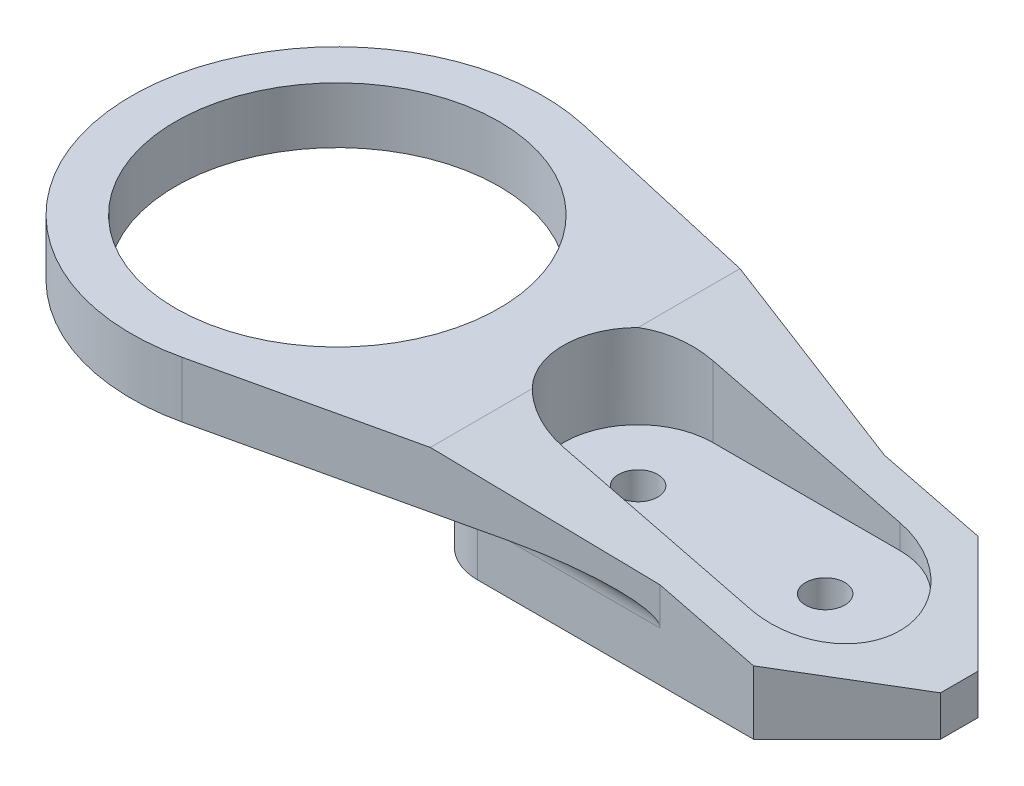
from build123d import *

# Parameters (mm, degrees)
SKETCH1_W           = 25
SKETCH1_H           = 7.15
BOSS_EXTRUDE1_DEPTH = 12
BOSS_EXTRUDE2_DEPTH = 3
CUT_EXTRUDE1_DEPTH  = 21
SKETCH4_R           = 8.65
CUT_EXTRUDE2_DEPTH  = 10
CHAMFER1_SIZE       = 5
CHAMFER1_SIZE2      = 20
CHAMFER2_SIZE       = 5
SKETCH6_R           = 1.05
CUT_EXTRUDE3_DEPTH  = 10
CUT_EXTRUDE4_DEPTH  = 4.5
FILLET1_R           = 3
FILLET2_R           = 1.5


with BuildPart() as part:
    # Sketch1 → Boss-Extrude1 (new body)
    with BuildSketch(Plane.XY):
        with Locations((12.5, 3.575)):
            Rectangle(SKETCH1_W, SKETCH1_H)
    extrude(amount=BOSS_EXTRUDE1_DEPTH)

    # Sketch2 → Boss-Extrude2 (add)
    with BuildSketch(Plane(origin=(0, 7.15, 0), x_dir=(1, 0, 0), z_dir=(0, 1, 0))):
        with BuildLine():
            Line((0, 0), (15, 0))
            Line((15, 0), (-5.804949202, 4.737516245))
            ThreePointArc((-5.804949202, 4.737516245), (-19.262380692, -6), (-5.804949202, -16.737516245))
            Line((-5.804949202, -16.737516245), (15, -12))
            Line((15, -12), (0, -12))
            Line((0, -12), (0, 0))
        make_face()
    extrude(amount=-BOSS_EXTRUDE2_DEPTH)

    # Sketch3 → Cut-Extrude1 (cut)
    with BuildSketch(Plane.XZ.offset(-4.15)):
        Polygon((2.25, 6), (2.25, 12), (0, 12), (0, 0), (2.25, 0), align=None)
    extrude(amount=CUT_EXTRUDE1_DEPTH, mode=Mode.SUBTRACT)

    # Sketch4 → Cut-Extrude2 (cut)
    with BuildSketch(Plane.XZ.offset(-4.15)):
        with Locations((-8.25, 6)):
            Circle(SKETCH4_R)
    extrude(amount=-CUT_EXTRUDE2_DEPTH, mode=Mode.SUBTRACT)

    # Chamfer1
    chamfer1_edges = [part.edges().sort_by_distance(p)[0] for p in [
        (25, 7.15, 6),
    ]]
    chamfer1_side = [part.faces().sort_by_distance(p)[0] for p in [
        (25, 3.575, 6),
    ]]
    chamfer(chamfer1_edges, length=CHAMFER1_SIZE, length2=CHAMFER1_SIZE2, reference=chamfer1_side[0])

    # Chamfer2
    chamfer2_edges = [part.edges().sort_by_distance(p)[0] for p in [
        (25, 1.075, 12),
        (25, 1.075, 0),
    ]]
    chamfer(chamfer2_edges, length=CHAMFER2_SIZE)

    # Sketch6 → Cut-Extrude3 (cut)
    with BuildSketch(Plane(origin=(0, 7.15, 0), x_dir=(1, 0, 0), z_dir=(0, 1, 0))):
        with Locations((7.829893366, -6)):
            Circle(SKETCH6_R)
        with Locations((17.829893366, -6)):
            Circle(SKETCH6_R)
    extrude(amount=-CUT_EXTRUDE3_DEPTH, mode=Mode.SUBTRACT)

    # Sketch7 → Cut-Extrude4 (cut)
    with BuildSketch(Plane(origin=(0, 7.15, 0), x_dir=(1, 0, 0), z_dir=(0, 1, 0))):
        with BuildLine():
            Line((7.829893366, -2), (17.829893366, -2))
            ThreePointArc((17.829893366, -2), (21.829893366, -6), (17.829893366, -10))
            Line((17.829893366, -10), (7.829893366, -10))
            ThreePointArc((7.829893366, -10), (3.829893366, -6), (7.829893366, -2))
        make_face()
    extrude(amount=-CUT_EXTRUDE4_DEPTH, mode=Mode.SUBTRACT)

    # Fillet1
    fillet1_edges = [part.edges().sort_by_distance(p)[0] for p in [
        (2.25, 2.075, 12),
        (2.25, 2.075, 0),
    ]]
    fillet(fillet1_edges, radius=FILLET1_R)

    # Fillet2
    fillet2_edges = [part.edges().sort_by_distance(p)[0] for p in [
        (10.125, 4.15, 12),
        (3.128679656, 4.15, 11.121320344),
        (2.25, 4.15, 6),
        (3.128679656, 4.15, 0.878679656),
        (10.125, 4.15, 0),
    ]]
    fillet(fillet2_edges, radius=FILLET2_R)


solid = part.part
